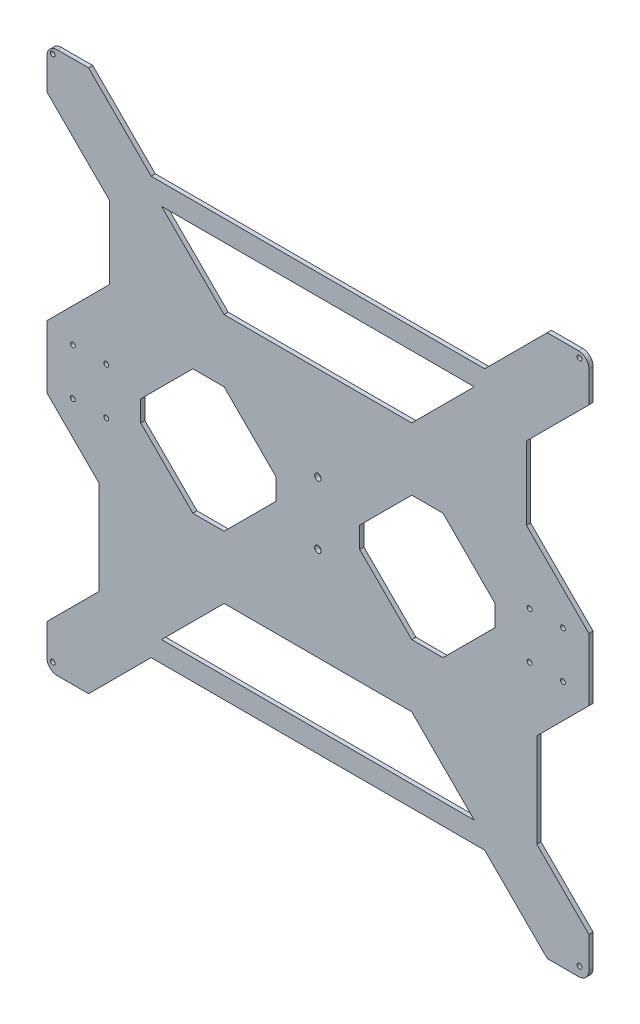
from build123d import *

# Parameters (mm, degrees)
MODEL_R             = 1.4605
MODEL_R_2           = 2
BOSS_EXTRUDE1_DEPTH = 1.27


with BuildPart() as part:
    # Model → Boss-Extrude1 (new, symmetric)
    with BuildSketch(Plane.XY):
        with BuildLine():
            Line((-290.681304326, 108.4317), (-252.581304326, 70.3317))
            Line((-252.581304326, 70.3317), (-252.581304326, 25.8817))
            Line((-252.581304326, 25.8817), (-290.681304326, -12.2183))
            Line((-290.681304326, -12.2183), (-290.681304326, -50.3183))
            Line((-290.681304326, -50.3183), (-258.931304326, -82.0683))
            Line((-258.931304326, -82.0683), (-258.931304326, -139.2183))
            Line((-258.931304326, -139.2183), (-290.681304326, -170.9683))
            Line((-290.681304326, -170.9683), (-290.681304326, -190.0183))
            ThreePointArc((-290.681304326, -190.0183), (-288.821432386, -194.508428061), (-284.331304326, -196.3683))
            Line((-284.331304326, -196.3683), (-265.281304326, -196.3683))
            Line((-265.281304326, -196.3683), (-227.181304326, -158.2683))
            Line((-227.181304326, -158.2683), (-23.981304326, -158.2683))
            Line((-23.981304326, -158.2683), (14.118695674, -196.3683))
            Line((14.118695674, -196.3683), (33.168695674, -196.3683))
            ThreePointArc((33.168695674, -196.3683), (37.658823735, -194.508428061), (39.518695674, -190.0183))
            Line((39.518695674, -190.0183), (39.518695674, -170.9683))
            Line((39.518695674, -170.9683), (7.768695674, -139.2183))
            Line((7.768695674, -139.2183), (7.768695674, -82.0683))
            Line((7.768695674, -82.0683), (22.457936385, -67.37905929))
            Line((22.457936385, -67.37905929), (39.518695674, -50.3183))
            Line((39.518695674, -50.3183), (39.518695674, -12.2183))
            Line((39.518695674, -12.2183), (1.418695674, 25.8817))
            Line((1.418695674, 25.8817), (1.418695674, 70.3317))
            Line((1.418695674, 70.3317), (39.518695674, 108.4317))
            Line((39.518695674, 108.4317), (39.518695674, 127.4817))
            ThreePointArc((39.518695674, 127.4817), (37.658823735, 131.971828061), (33.168695674, 133.8317))
            Line((33.168695674, 133.8317), (14.118695674, 133.8317))
            Line((14.118695674, 133.8317), (-23.981304326, 95.7317))
            Line((-23.981304326, 95.7317), (-227.181304326, 95.7317))
            Line((-227.181304326, 95.7317), (-265.281304326, 133.8317))
            Line((-265.281304326, 133.8317), (-284.331304326, 133.8317))
            ThreePointArc((-284.331304326, 133.8317), (-288.821432386, 131.971828061), (-290.681304326, 127.4817))
            Line((-290.681304326, 127.4817), (-290.681304326, 108.4317))
        make_face()
        with Locations((-287.125304326, -190.6025)):
            Circle(MODEL_R, mode=Mode.SUBTRACT)
        with Locations((-274.841304256, -45.4288)):
            Circle(MODEL_R, mode=Mode.SUBTRACT)
        with Locations((-254.521304256, -45.4288)):
            Circle(MODEL_R, mode=Mode.SUBTRACT)
        Polygon((-68.431304326, -107.4683), (-30.331304326, -145.5683), (-220.831304326, -145.5683), (-182.731304326, -107.4683), align=None, mode=Mode.SUBTRACT)
        with Locations((33.752895674, -190.6025)):
            Circle(MODEL_R, mode=Mode.SUBTRACT)
        with Locations((-125.581304326, -50.3183)):
            Circle(MODEL_R_2, mode=Mode.SUBTRACT)
        Polygon((-68.431304326, -69.3683), (-100.181304326, -37.6183), (-100.181304326, -24.9183), (-68.431304326, 6.8317), (-49.381304326, 6.8317), (-17.631304326, -24.9183), (-17.631304326, -37.6183), (-49.381304326, -69.3683), align=None, mode=Mode.SUBTRACT)
        with Locations((3.358695604, -45.4288)):
            Circle(MODEL_R, mode=Mode.SUBTRACT)
        with Locations((23.678695604, -45.4288)):
            Circle(MODEL_R, mode=Mode.SUBTRACT)
        with Locations((-274.841304256, -17.1078)):
            Circle(MODEL_R, mode=Mode.SUBTRACT)
        with Locations((-254.521304256, -17.1078)):
            Circle(MODEL_R, mode=Mode.SUBTRACT)
        Polygon((-182.731304326, -69.3683), (-201.781304326, -69.3683), (-233.531304326, -37.6183), (-233.531304326, -24.9183), (-201.781304326, 6.8317), (-182.731304326, 6.8317), (-150.981304326, -24.9183), (-150.981304326, -37.6183), align=None, mode=Mode.SUBTRACT)
        with Locations((-287.125304326, 130.2757)):
            Circle(MODEL_R, mode=Mode.SUBTRACT)
        with Locations((-125.581304326, -12.2183)):
            Circle(MODEL_R_2, mode=Mode.SUBTRACT)
        with Locations((3.358695604, -17.1078)):
            Circle(MODEL_R, mode=Mode.SUBTRACT)
        with Locations((23.678695604, -17.1078)):
            Circle(MODEL_R, mode=Mode.SUBTRACT)
        Polygon((-182.731304326, 44.9317), (-220.831304326, 83.0317), (-30.331304326, 83.0317), (-68.431304326, 44.9317), align=None, mode=Mode.SUBTRACT)
        with Locations((33.752895674, 130.2757)):
            Circle(MODEL_R, mode=Mode.SUBTRACT)
    extrude(amount=BOSS_EXTRUDE1_DEPTH, both=True)


solid = part.part
